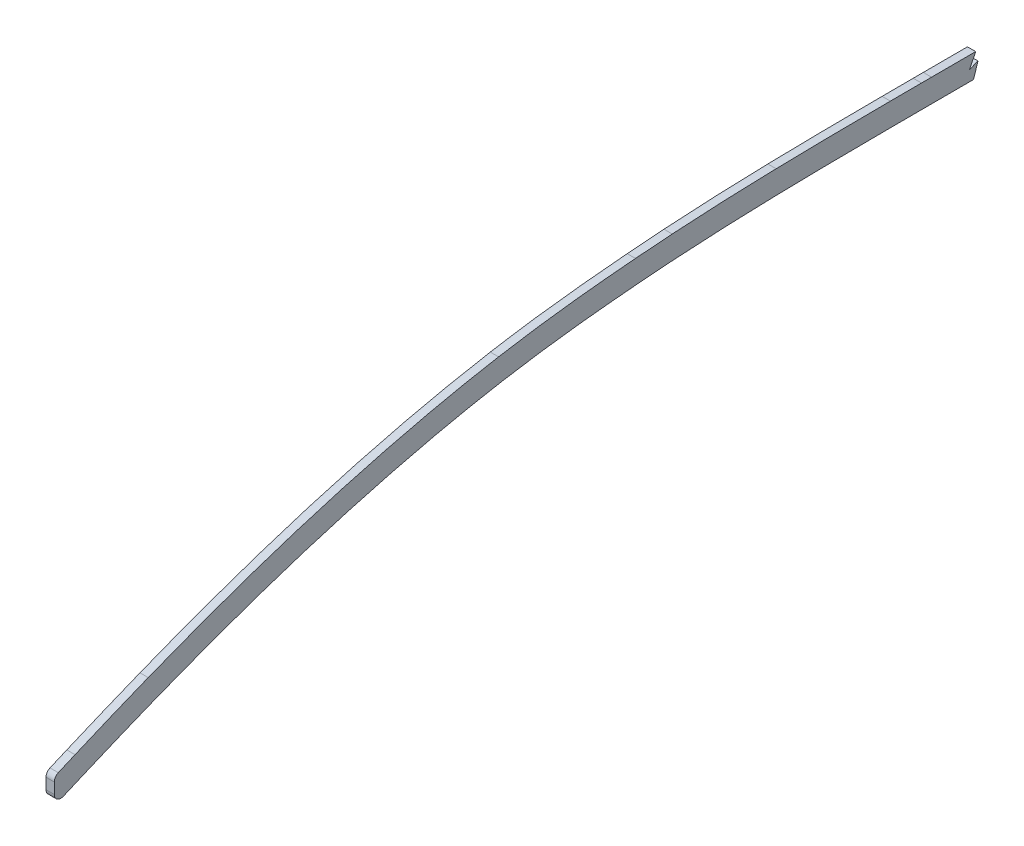
from build123d import *

# Parameters (mm, degrees)
BOSS_EXTRUDE1_START = -1.5875
BOSS_EXTRUDE1_DEPTH = 3.175
FILLET1_R           = 2.54
CUT_EXTRUDE1_DEPTH  = 2674.191025632
FILLET2_R           = 0.762
FILLET3_R           = 0.762
CUT_EXTRUDE2_DEPTH  = 7.62


with BuildPart() as part:
    # Boss-Extrude1: read off the stored shape, not the designer's step
    # Boss-Extrude1 outline → Boss-Extrude1 (new body)
    with BuildSketch(Plane(origin=(0, 0, 0), x_dir=(0, 0, -1), z_dir=(1, 0, 0)).offset(BOSS_EXTRUDE1_START)):
        with BuildLine():
            add(Edge.make_bspline(
                [(1110.404970926, 130.384545774), (1120.170834465, 130.370061323), (1139.703057908, 130.338772026), (1168.998370974, 130.277673039), (1198.290610395, 130.194386876), (1217.81419633, 130.113940836), (1227.576506903, 130.06508052)],
                knots=[0, 0, 0, 0, 0.25, 0.5, 0.75, 1, 1, 1, 1], degree=3))
            add(Edge.make_bspline(
                [(1227.576506903, 130.06508052), (1269.911205773, 129.853195249), (1333.427746701, 129.273373321), (1418.042208161, 127.449050563), (1502.665994832, 124.913583682), (1608.454176987, 120.803299479), (1693.070073331, 116.848243245), (1735.369787733, 114.744712179)],
                knots=[0, 0, 0, 0, 0.25, 0.375, 0.5, 0.75, 1, 1, 1, 1], degree=3))
            add(Edge.make_bspline(
                [(1735.369787733, 114.744712179), (1815.995940723, 110.735232018), (1936.906650462, 104.096364548), (2098.049485168, 94.18797875), (2198.694736725, 87.314638509), (2279.130413747, 81.114418931), (2339.412950304, 76.034076608), (2399.564054334, 70.28270545), (2479.570468264, 61.127378254), (2559.292087872, 49.650907614), (2626.797554585, 38.235484735), (2656.889518578, 32.788503969), (2667.159793662, 30.877771266), (2669.54, 30.432069924)],
                knots=[0, 0, 0, 0, 0.25, 0.375, 0.5, 0.5625, 0.625, 0.6875, 0.75, 0.875, 0.9375, 0.96241067, 0.969928536, 0.969928536, 0.969928536, 0.969928536], degree=3))
            Line((2669.54, 30.432069924), (2669.54, 39.476142465))
            add(Edge.make_bspline(
                [(1735.811334709, 123.623740069), (1776.138635499, 121.618292624), (1816.460281579, 119.500621806), (1897.093668675, 115.087561885), (1937.405638896, 112.792971084), (2018.018419045, 108.018366523), (2058.319512223, 105.539122976), (2138.903780144, 100.307240032), (2179.18739793, 97.555127955), (2239.586998714, 93.080168687), (2259.716280977, 91.529837622), (2289.900442602, 89.09084343), (2299.960179135, 88.258845039), (2320.076004566, 86.552861654), (2330.132100898, 85.678962223), (2350.239356518, 83.874334847), (2360.290489794, 82.943307484), (2380.385973971, 81.003183297), (2390.430065378, 79.993418555), (2420.547026195, 76.827577532), (2440.60648589, 74.533672955), (2480.675569568, 69.556278523), (2500.68715183, 66.874150811), (2540.654290207, 61.150246295), (2560.611026428, 58.109755646), (2600.475457131, 51.702465574), (2620.382967089, 48.337538888), (2650.028116889, 43.072156367), (2659.78844051, 41.29687683), (2669.54, 39.476142465)],
                knots=[0, 0, 0, 0, 0.125, 0.125, 0.25, 0.25, 0.375, 0.375, 0.5, 0.5, 0.5625, 0.5625, 0.59375, 0.59375, 0.625, 0.625, 0.65625, 0.65625, 0.6875, 0.6875, 0.75, 0.75, 0.8125, 0.8125, 0.875, 0.875, 0.9375, 0.9375, 0.968210768, 0.968210768, 0.968210768, 0.968210768], degree=3))
            add(Edge.make_bspline(
                [(1227.621000751, 138.954969175), (1248.807303679, 138.848931677), (1269.993583155, 138.701170252), (1312.363832348, 138.270664618), (1333.547719008, 137.987407832), (1375.912368189, 137.249274813), (1397.09309738, 136.7925677), (1439.451328259, 135.701855835), (1460.629010312, 135.069210584), (1502.979101161, 133.670541385), (1524.152152736, 132.907434339), (1566.494303759, 131.284732459), (1587.663166024, 130.423163385), (1651.164052809, 127.709123983), (1693.490421561, 125.728325331), (1735.811334709, 123.623740069)],
                knots=[0, 0, 0, 0, 0.125, 0.125, 0.25, 0.25, 0.375, 0.375, 0.5, 0.5, 0.625, 0.625, 0.75, 0.75, 1, 1, 1, 1], degree=3))
            add(Edge.make_bspline(
                [(1110.418156307, 139.274535996), (1129.952027249, 139.245563914), (1149.485893504, 139.211997476), (1188.553558893, 139.115899087), (1208.087346834, 139.052735015), (1227.621000751, 138.954969175)],
                knots=[0, 0, 0, 0, 0.5, 0.5, 1, 1, 1, 1], degree=3))
            add(Edge.make_bspline(
                [(768.740124165, 138.468408213), (782.976796045, 138.460280143), (797.213453801, 138.479500079), (825.686695051, 138.549690296), (839.923258916, 138.600062665), (868.396318956, 138.719026333), (882.632808962, 138.789607972), (911.105746117, 138.939594729), (925.342197007, 139.018479563), (953.81517223, 139.160090703), (968.051699178, 139.222241505), (996.524919377, 139.30995407), (1010.761605517, 139.335014039), (1039.234912871, 139.349647552), (1053.471562869, 139.340493535), (1081.944860968, 139.313691902), (1096.181508981, 139.29565137), (1110.418156307, 139.274535996)],
                knots=[0, 0, 0, 0, 0.125, 0.125, 0.25, 0.25, 0.375, 0.375, 0.5, 0.5, 0.625, 0.625, 0.75, 0.75, 0.875, 0.875, 1, 1, 1, 1], degree=3))
            add(Edge.make_bspline(
                [(630.778432202, 139.251437536), (653.771819614, 139.075315664), (676.765000849, 138.871740519), (711.255349111, 138.647690701), (722.752238945, 138.586174182), (745.746099074, 138.499784896), (757.243084259, 138.474972158), (768.740124165, 138.468408213)],
                knots=[0, 0, 0, 0, 0.5, 0.5, 0.75, 0.75, 1, 1, 1, 1], degree=3))
            add(Edge.make_bspline(
                [(604.514984259, 139.433685568), (609.940743136, 139.400696354), (618.695242427, 139.342071397), (627.449694696, 139.276935028), (630.778432202, 139.251437536)],
                knots=[0, 0, 0, 0, 0.619765686, 1, 1, 1, 1], degree=3))
            ThreePointArc((604.514984259, 139.433685568), (600.549356142, 139.457173081), (596.583720644, 139.479379304))
            add(Edge.make_bspline(
                [(436.133018826, 139.357176562), (449.50393779, 139.390650739), (462.874888934, 139.412366015), (489.61665939, 139.498555977), (502.987497127, 139.559076553), (529.729299233, 139.628029754), (543.100240501, 139.639230481), (569.84212102, 139.601013959), (583.212960696, 139.552035302), (596.583720644, 139.479379304)],
                knots=[0, 0, 0, 0, 0.25, 0.25, 0.5, 0.5, 0.75, 0.75, 1, 1, 1, 1], degree=3))
            add(Edge.make_bspline(
                [(432.263917423, 139.347117104), (433.553617637, 139.350567112), (434.843318039, 139.353947814), (436.133018826, 139.357176562)],
                knots=[0, 0, 0, 0, 1, 1, 1, 1], degree=3))
            add(Edge.make_bspline(
                [(420.316232014, 139.305761868), (422.413235913, 139.315186344), (426.395793967, 139.330351666), (430.378363115, 139.342073082), (432.263917423, 139.347117104)],
                knots=[0, 0, 0, 0, 0.526548575, 1, 1, 1, 1], degree=3))
            add(Edge.make_bspline(
                [(376.410119779, 138.75403864), (383.726317086, 138.935561778), (391.043801196, 139.055611797), (405.679602634, 139.224192856), (412.997895507, 139.272871444), (420.316232014, 139.305761868)],
                knots=[0, 0, 0, 0, 0.5, 0.5, 1, 1, 1, 1], degree=3))
            add(Edge.make_bspline(
                [(336.49221538, 137.002990798), (349.782924989, 137.88646357), (363.094318653, 138.423658969), (376.410119779, 138.75403864)],
                knots=[0, 0, 0, 0, 1, 1, 1, 1], degree=3))
            add(Edge.make_bspline(
                [(322.369488076, 135.928469458), (327.073374868, 136.333386449), (331.781331813, 136.689844531), (336.49221538, 137.002990798)],
                knots=[0, 0, 0, 0, 1, 1, 1, 1], degree=3))
            add(Edge.make_bspline(
                [(269.769949315, 129.47895505), (274.123387467, 130.231879276), (278.485668028, 130.925946417), (287.22796256, 132.196043087), (291.608626646, 132.771988738), (300.381777496, 133.818422146), (304.774579419, 134.288963443), (313.567800313, 135.154375086), (317.967903853, 135.549407043), (322.369488076, 135.928469458)],
                knots=[0, 0, 0, 0, 0.25, 0.25, 0.5, 0.5, 0.75, 0.75, 1, 1, 1, 1], degree=3))
            add(Edge.make_bspline(
                [(135.15718457, 90.054634926), (146.043739673, 94.375230064), (156.99891695, 98.504335222), (173.56622243, 104.322560697), (179.110932848, 106.199810145), (190.24859245, 109.819698901), (195.841545849, 111.562316625), (207.065472514, 114.901345648), (212.697969124, 116.49836249), (224.005973618, 119.540534541), (229.683240596, 120.9862349), (246.767187276, 125.077694043), (258.225188059, 127.482295924), (269.769949315, 129.47895505)],
                knots=[0, 0, 0, 0, 0.25, 0.25, 0.375, 0.375, 0.5, 0.5, 0.625, 0.625, 0.75, 0.75, 1, 1, 1, 1], degree=3))
            add(Edge.make_bspline(
                [(107.049744533, 78.466050261), (116.373258882, 82.438606419), (125.737350123, 86.316143859), (135.15718457, 90.054634926)],
                knots=[0, 0, 0, 0, 1, 1, 1, 1], degree=3))
            add(Edge.make_bspline(
                [(99.06, 75.03568963), (99.223542669, 75.106424562), (100.635498802, 75.716852689), (103.297453866, 76.863328103), (105.798503999, 77.932922637), (107.049744533, 78.466050261)],
                knots=[0.484151133, 0.484151133, 0.484151133, 0.484151133, 0.515864471, 0.757931449, 1, 1, 1, 1], degree=3))
            Line((99.06, 75.03568963), (99.06, 65.345043949))
            add(Edge.make_bspline(
                [(99.06, 65.345043949), (99.380370965, 65.484464523), (100.637671455, 66.031176319), (103.17753745, 67.132002814), (106.681577323, 68.64166857), (109.249580285, 69.740028797), (110.534459652, 70.287489229)],
                knots=[0.254738807, 0.254738807, 0.254738807, 0.254738807, 0.317238807, 0.5, 0.75, 1, 1, 1, 1], degree=3))
            add(Edge.make_bspline(
                [(110.534459652, 70.287489229), (112.850658013, 71.274373329), (117.489277519, 73.236837099), (124.456688526, 76.138068453), (131.438476528, 78.994265342), (136.101204469, 80.864754132), (138.436571012, 81.791601309)],
                knots=[0, 0, 0, 0, 0.25, 0.5, 0.75, 1, 1, 1, 1], degree=3))
            add(Edge.make_bspline(
                [(138.436571012, 81.791601309), (143.826897197, 83.930883835), (154.6522834, 88.11877139), (176.408203186, 96.037596764), (203.906835742, 104.998187521), (237.39469787, 114.027149543), (259.934818065, 118.755998441), (271.284977744, 120.719001348)],
                knots=[0, 0, 0, 0, 0.125, 0.25, 0.5, 0.75, 1, 1, 1, 1], degree=3))
            add(Edge.make_bspline(
                [(271.284977744, 120.719001348), (275.558711595, 121.458140765), (284.124297478, 122.821139095), (297.036360548, 124.518896272), (310.018420247, 125.909880891), (318.766623126, 126.695286194), (323.13209925, 127.071239405)],
                knots=[5e-09, 5e-09, 5e-09, 5e-09, 0.2499992, 0.4999984, 0.7499976, 0.999996801, 0.999996801, 0.999996801, 0.999996801], degree=3))
            add(Edge.make_bspline(
                [(323.13209925, 127.071239405), (324.293050056, 127.171175344), (326.615168427, 127.365043892), (330.101568176, 127.638529754), (333.590184216, 127.895089457), (335.917953069, 128.055198639), (337.081858513, 128.132566852)],
                knots=[1.2024e-05, 1.2024e-05, 1.2024e-05, 1.2024e-05, 0.250009018, 0.500006012, 0.750003006, 1, 1, 1, 1], degree=3))
            add(Edge.make_bspline(
                [(337.081858513, 128.132566852), (340.367862287, 128.350997241), (346.939906877, 128.744909116), (356.821319657, 129.221190111), (366.716250393, 129.595096292), (373.326613137, 129.784797569), (376.630622597, 129.866773678)],
                knots=[0, 0, 0, 0, 0.25, 0.5, 0.75, 1, 1, 1, 1], degree=3))
            add(Edge.make_bspline(
                [(376.630622597, 129.866773678), (380.266394474, 129.956981294), (387.534764147, 130.106779908), (398.462206547, 130.259361028), (409.400972015, 130.358727994), (416.705417778, 130.39944419), (420.356185481, 130.415851648)],
                knots=[0, 0, 0, 0, 0.25, 0.5, 0.75, 1, 1, 1, 1], degree=3))
            add(Edge.make_bspline(
                [(420.356185481, 130.415851648), (421.350045129, 130.420318309), (423.337533562, 130.428603137), (426.320174328, 130.439402209), (429.303468332, 130.448883952), (431.293011648, 130.454488038), (432.287698861, 130.457148912)],
                knots=[0, 0, 0, 0, 0.25, 0.5, 0.75, 1, 1, 1, 1], degree=3))
            add(Edge.make_bspline(
                [(432.287698861, 130.457148912), (432.610032304, 130.45801117), (433.254717136, 130.45972707), (434.221637716, 130.462266911), (435.188505114, 130.464765142), (435.833012253, 130.466397641), (436.155274747, 130.46720442)],
                knots=[9.2e-08, 9.2e-08, 9.2e-08, 9.2e-08, 0.25, 0.5, 0.75, 1, 1, 1, 1], degree=3))
            add(Edge.make_bspline(
                [(436.155274747, 130.46720442), (449.528322363, 130.500683927), (476.275740382, 130.546633815), (516.38896029, 130.728798697), (556.456290895, 130.759667498), (583.176533448, 130.662101975), (596.535396133, 130.589510646)],
                knots=[0, 0, 0, 0, 0.249999973, 0.499999946, 0.749999918, 0.999999891, 0.999999891, 0.999999891, 0.999999891], degree=3))
            ThreePointArc((596.535396133, 130.589510646), (600.498158983, 130.567320504), (604.460914457, 130.543849998))
            add(Edge.make_bspline(
                [(604.460914457, 130.543849998), (606.648150431, 130.530551362), (611.022503017, 130.502867011), (617.584689429, 130.458405465), (624.147187284, 130.411339888), (628.522663802, 130.378455494), (630.7103385, 130.361698324)],
                knots=[-7.09e-07, -7.09e-07, -7.09e-07, -7.09e-07, 0.249999468, 0.499999646, 0.749999823, 1, 1, 1, 1], degree=3))
            add(Edge.make_bspline(
                [(630.7103385, 130.361698324), (642.206126489, 130.273644326), (665.193556095, 130.083785311), (699.699077953, 129.819212193), (734.21504011, 129.634735151), (757.228597075, 129.58497898), (768.735048644, 129.578409662)],
                knots=[0, 0, 0, 0, 0.25, 0.5, 0.75, 1, 1, 1, 1], degree=3))
            add(Edge.make_bspline(
                [(768.735048644, 129.578409662), (797.222409768, 129.56214552), (854.203652026, 129.725124503), (939.635195481, 130.236578518), (1024.992958464, 130.524931921), (1081.937612336, 130.426767717), (1110.404970926, 130.384545774)],
                knots=[0, 0, 0, 0, 0.25, 0.5, 0.75, 1, 1, 1, 1], degree=3))
        make_face()
    extrude(amount=BOSS_EXTRUDE1_DEPTH)

    # Fillet1
    fillet1_edges = [part.edges().sort_by_distance(p)[0] for p in [
        (0, 39.476142465, -2669.54),
        (0, 30.432069924, -2669.54),
        (0, 65.345043949, -99.06),
        (0, 75.03568963, -99.06),
    ]]
    fillet(fillet1_edges, radius=FILLET1_R)

    # Sketch4 → Cut-Extrude1 (cut, through all)
    with BuildSketch(Plane(origin=(1.5875, 0, 0), x_dir=(0, 0, -1), z_dir=(1, 0, 0))):
        Polygon((1827.2125, 118.895836595), (1827.2125, 110.000384115), (1827.2125, 78.791710134), (2135.1875, 78.791710134), (2135.1875, 91.599357392), (2135.1875, 100.508307819), (2135.1875, 129.353842083), (1827.2125, 129.353842083), align=None)
    extrude(amount=-CUT_EXTRUDE1_DEPTH, mode=Mode.SUBTRACT)


with BuildPart() as cut_extrude1_piece_1:
    # of the separate pieces the step leaves, piece 1, a body of its own (cut_extrude1_pieces)
    add(part.part.solids().sort_by_distance((-1.5875, 114.744712179, -1735.369787733))[0])

    # Fillet2
    fillet2_edges = [cut_extrude1_piece_1.edges().sort_by_distance(p)[0] for p in [
        (0, 118.895836595, -1827.2125),
        (0, 110.000384116, -1827.2125),
    ]]
    fillet(fillet2_edges, radius=FILLET2_R)


with BuildPart() as cut_extrude1_piece_2:
    # of the separate pieces the step leaves, piece 2, a body of its own (cut_extrude1_pieces)
    add(part.part.solids().sort_by_distance((-1.5875, 91.599357392, -2135.1875))[0])

    # Fillet3
    fillet3_edges = [cut_extrude1_piece_2.edges().sort_by_distance(p)[0] for p in [
        (0, 100.508307819, -2135.1875),
        (0, 91.599357392, -2135.1875),
    ]]
    fillet(fillet3_edges, radius=FILLET3_R)


with BuildPart() as cut_extrude2_tool:
    # Sketch5 → Cut-Extrude2 (new body)
    with BuildSketch(Plane(origin=(1.5875, 0, 0), x_dir=(0, 0, -1), z_dir=(1, 0, 0))):
        Polygon((453.088349995, 139.395824167), (450.752036301, 134.613422753), (453.975418286, 135.844351639), (452.268768997, 130.504363999), (452.268768997, 120.265529488), (2798.774335261, -181.4514548), (2948.646980362, 339.158786075), (453.088349995, 144.042560639), align=None)
    extrude(amount=-CUT_EXTRUDE2_DEPTH)


with BuildPart() as cut_extrude1_piece_1_1:
    add(cut_extrude1_piece_1.part)

    # Cut-Extrude2: cut by cut_extrude2_tool
    add(cut_extrude2_tool.part, mode=Mode.SUBTRACT)


with BuildPart() as cut_extrude1_piece_2_1:
    add(cut_extrude1_piece_2.part)

    # Cut-Extrude2: cut by cut_extrude2_tool
    add(cut_extrude2_tool.part, mode=Mode.SUBTRACT)


solid = cut_extrude1_piece_1_1.part
